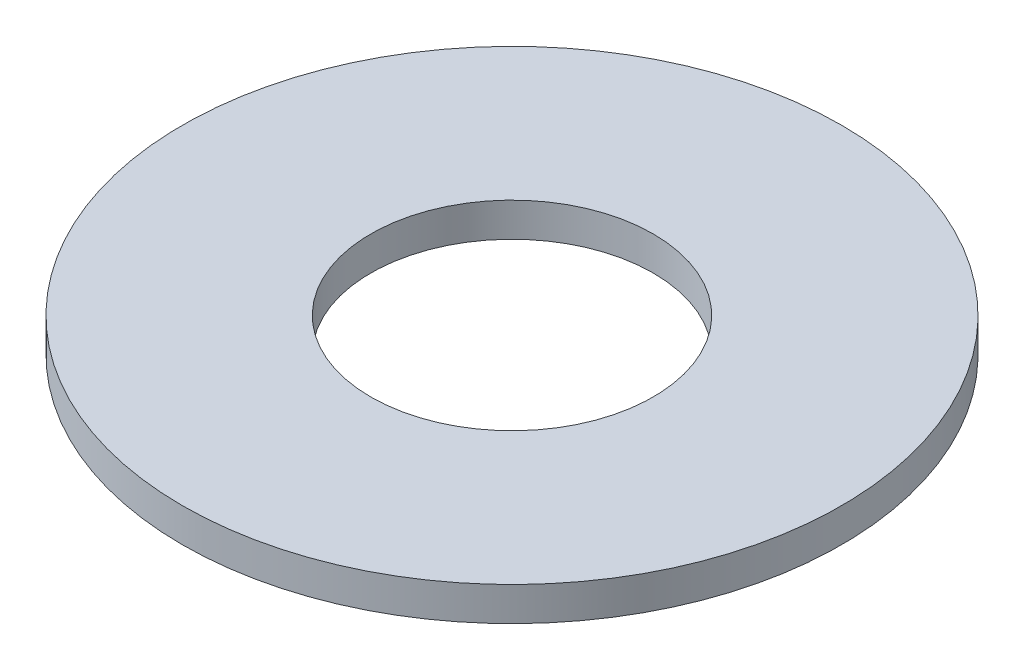
from build123d import *

# Parameters (mm, degrees)
SKETCH1_R           = 87.5
BOSS_EXTRUDE1_DEPTH = 9
SKETCH2_R           = 37.5
CUT_EXTRUDE1_DEPTH  = 125.07054445


with BuildPart() as part:
    # Sketch1 → Boss-Extrude1 (new body)
    with BuildSketch(Plane(origin=(0, 0, 0), x_dir=(1, 0, 0), z_dir=(0, 1, 0))):
        Circle(SKETCH1_R)
    extrude(amount=BOSS_EXTRUDE1_DEPTH)

    # Sketch2 → Cut-Extrude1 (cut, through all)
    with BuildSketch(Plane(origin=(0, 0, 0), x_dir=(1, 0, 0), z_dir=(0, 1, 0))):
        Circle(SKETCH2_R)
    extrude(amount=CUT_EXTRUDE1_DEPTH, mode=Mode.SUBTRACT)


solid = part.part
